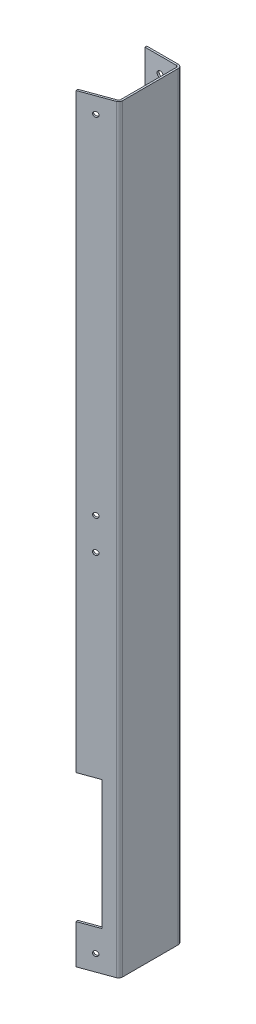
from build123d import *

# Parameters (mm, degrees)
SKETCH1_W                    = 600
SKETCH1_H                    = 100
BASE_FLANGE1_DEPTH           = 1.5
SKETCHED_START               = -300
SKETCHED_BEND1_DEPTH         = 600
SKETCHED_BEND1_2_DEPTH       = 600
SKETCHED_BEND2_DEPTH         = 600
SKETCHED_BEND2_2_DEPTH       = 600
F_4_0_4_DIAMETER_HOLE1_D     = 4
F_5_0_5_DIAMETER_HOLE1_D     = 5
F_5_0_5_DIAMETER_HOLE1_DEPTH = 1.5
CUT_EXTRUDE1_REACH           = 307.656
SKETCH12_W                   = 102
SKETCH12_H                   = 16


# Read off the part's stored shape, not the designer's step: Sketched Bend1, Sketched Bend2
# Sheet-metal steps are written as plain solids
with BuildPart() as part:
    # Sketch1 → Base-Flange1 (new body)
    with BuildSketch(Plane.YZ):
        Rectangle(SKETCH1_W, SKETCH1_H)
    extrude(amount=-BASE_FLANGE1_DEPTH)

    # Sketched Bend1 outline → Sketched Bend1 (cut)
    with BuildSketch(Plane(origin=(0, 0, 0), x_dir=(1, 0, 0), z_dir=(0, 1, 0)).offset(SKETCHED_START)):
        with BuildLine():
            Line((-1.5, 50), (-1.5, 24.198076212))
            ThreePointArc((-1.5, 24.198076212), (-0.401923788, 23.1), (0, 21.6))
            Line((0, 21.6), (0, 50))
            Line((0, 50), (-1.5, 50))
        make_face()
    extrude(amount=SKETCHED_BEND1_DEPTH, mode=Mode.SUBTRACT)

    # Sketched Bend1 2 outline → Sketched Bend1 2 (add)
    with BuildSketch(Plane(origin=(0, 0, 0), x_dir=(1, 0, 0), z_dir=(0, 1, 0)).offset(SKETCHED_START)):
        with BuildLine():
            Line((-27.865708265, 24.6), (-27.865708265, 23.1))
            Line((-27.865708265, 23.1), (-3, 23.1))
            ThreePointArc((-3, 23.1), (-1.939339828, 22.660660172), (-1.5, 21.6))
            Line((-1.5, 21.6), (-1.5, 24.198076212))
            ThreePointArc((-1.5, 24.198076212), (-2.223542865, 24.497777479), (-3, 24.6))
            Line((-3, 24.6), (-27.865708265, 24.6))
        make_face()
    extrude(amount=SKETCHED_BEND1_2_DEPTH)

    # Sketched Bend2 outline → Sketched Bend2 (cut)
    with BuildSketch(Plane(origin=(0, 0, 0), x_dir=(1, 0, 0), z_dir=(0, 1, 0)).offset(SKETCHED_START)):
        with BuildLine():
            ThreePointArc((0, -22.499377385), (-0.401923789, -23.999377385), (-1.5, -25.097453597))
            Line((-1.5, -25.097453597), (-1.5, -50))
            Line((-1.5, -50), (0, -50))
            Line((0, -50), (0, -22.499377385))
        make_face()
    extrude(amount=SKETCHED_BEND2_DEPTH, mode=Mode.SUBTRACT)

    # Sketched Bend2 2 outline → Sketched Bend2 2 (add)
    with BuildSketch(Plane(origin=(0, 0, 0), x_dir=(1, 0, 0), z_dir=(0, 1, 0)).offset(SKETCHED_START)):
        with BuildLine():
            ThreePointArc((-1.5, -22.499377385), (-1.771271934, -23.35974204), (-2.486969785, -23.908916317))
            Line((-2.486969785, -23.908916317), (-25.745986918, -32.374506231))
            Line((-25.745986918, -32.374506231), (-25.232956703, -33.784045162))
            Line((-25.232956703, -33.784045162), (-1.97393957, -25.318455248))
            ThreePointArc((-1.97393957, -25.318455248), (-1.732145215, -25.218300747), (-1.5, -25.097453597))
            Line((-1.5, -25.097453597), (-1.5, -22.499377385))
        make_face()
    extrude(amount=SKETCHED_BEND2_2_DEPTH)

    # Ø4.0 (4) Diameter Hole1 (through all)
    with Locations(Plane(origin=(7.906287599, 0, 21.72234665), x_dir=(0.9396926207859094, 0, -0.34202014332566616), z_dir=(0.34202014332566616, 0, 0.9396926207859094))):
        with Locations((-23.21431814, 287.3), (-23.21431814, 12.7)):
            f_4_0_4_diameter_hole1 = Hole(F_4_0_4_DIAMETER_HOLE1_D / 2)

    # Mirror1: Ø4.0 (4) Diameter Hole1 across plane
    add(f_4_0_4_diameter_hole1.mirror(Plane.ZX), mode=Mode.SUBTRACT)

    # Ø5.0 (5) Diameter Hole1
    with Locations(Plane.YX.offset(24.6)):
        with Locations((-287.3, -15.7), (-87.3, -15.7), (87.3, -15.7), (287.3, -15.7)):
            Hole(F_5_0_5_DIAMETER_HOLE1_D / 2, depth=F_5_0_5_DIAMETER_HOLE1_DEPTH)

    # Sketch12 → Cut-Extrude1 (cut, up to next)
    with BuildSketch(Plane(origin=(7.906287599, 0, 21.72234665), x_dir=(0, -1, 0), z_dir=(0.34202014332566616, 0, 0.9396926207859094)), mode=Mode.PRIVATE) as cut_extrude1_sk1:
        with Locations((218, -27.266047183)):
            Rectangle(SKETCH12_W, SKETCH12_H)
    cut_extrude1_tool1 = extrude(cut_extrude1_sk1.sketch, amount=-CUT_EXTRUDE1_REACH, mode=Mode.PRIVATE) & part.part
    add(cut_extrude1_tool1.solids().sort_by_distance((-17.715416, -218, 31.047884))[0], mode=Mode.SUBTRACT)


solid = part.part
